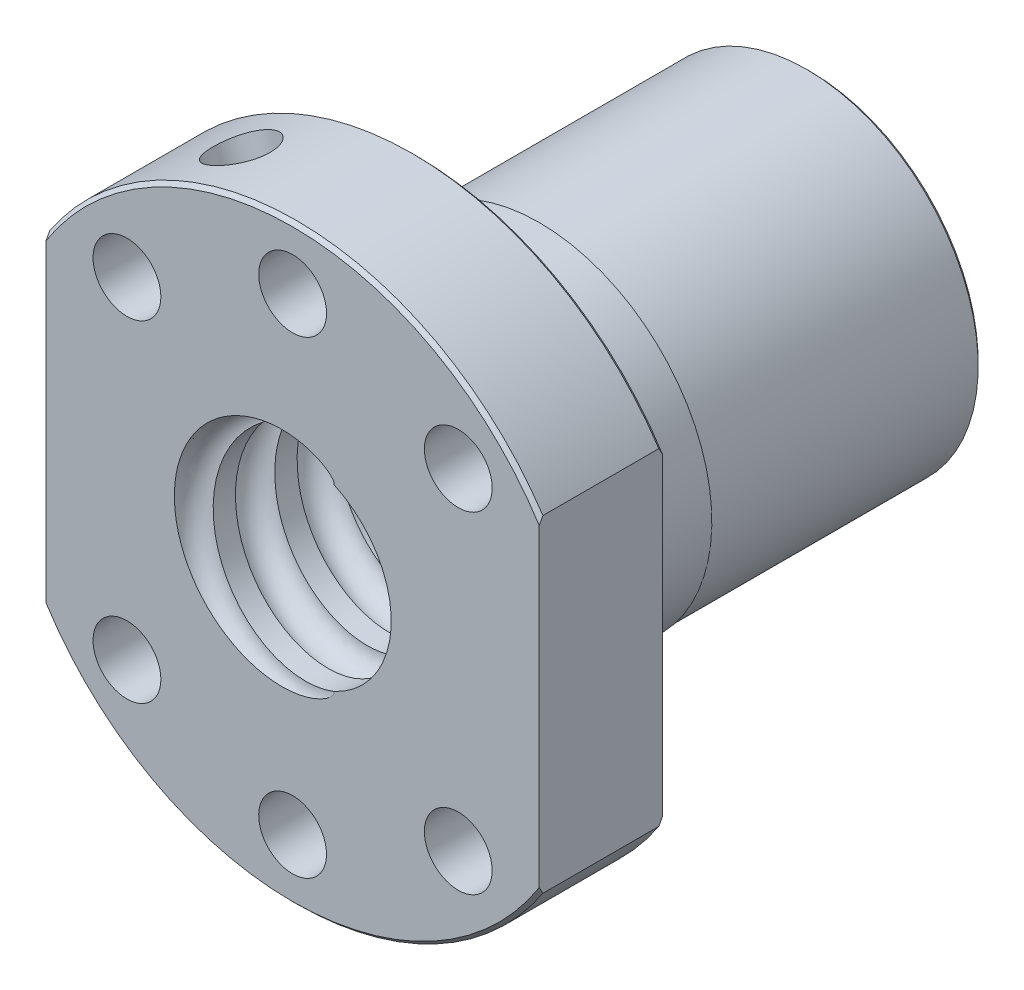
from build123d import *

# Parameters (mm, degrees)
SKETCH2_W                  = 14
SKETCH2_H                  = 26.532998322
CUT_EXTRUDE1_DEPTH         = 10
F_25_0_25_DIAMETER_HOLE1_D = 16
F_6_6_6_6_DIAMETER_HOLE1_D = 5.5
CIRPATTERN1_COUNT          = 8
SKETCH11_W                 = 2.5
SKETCH11_H                 = 29.826777428
CUT_SWEEP1_PITCH           = 5
CHAMFER1_SIZE              = 0.3


with BuildPart() as part:
    # Sketch1 → Revolve1 (revolve)
    with BuildSketch(Plane(origin=(0, 0, 0), x_dir=(0, 0, -1), z_dir=(1, 0, 0))):
        Polygon((0, 0), (0, 24), (10, 24), (10, 14), (20, 14), (20, 13.9), (42, 13.9), (42, 0), align=None)
    revolve(axis=Axis((0, 0, -42), (0, 0, 1)))

    # Sketch2 → Cut-Extrude1 (cut)
    with BuildSketch(Plane.XY):
        with Locations((-27, 0)):
            Rectangle(SKETCH2_W, SKETCH2_H)
        with Locations((27, 0)):
            Rectangle(SKETCH2_W, SKETCH2_H)
    extrude(amount=-CUT_EXTRUDE1_DEPTH, mode=Mode.SUBTRACT)

    # Ø25.0 (25) Diameter Hole1 (through all)
    with Locations(Plane(origin=(0, 0, -42), x_dir=(-1, 0, 0), z_dir=(0, 0, -1))):
        with Locations((0, 0)):
            Hole(F_25_0_25_DIAMETER_HOLE1_D / 2)

    # Ø6.6 (6.6) Diameter Hole1 (through all)
    with Locations(Plane.XY):
        with Locations((0, 19)):
            f_6_6_6_6_diameter_hole1 = Hole(F_6_6_6_6_DIAMETER_HOLE1_D / 2)

    # CirPattern1: Ø6.6 (6.6) Diameter Hole1 ×8 about axis, 2 skipped
    cirpattern1_axis = Axis((0, 0, 0), (0, 0, -1))
    add([f_6_6_6_6_diameter_hole1.rotate(cirpattern1_axis, i * 360 / CIRPATTERN1_COUNT) for i in range(1, CIRPATTERN1_COUNT) if i not in (2, 6)], mode=Mode.SUBTRACT)

    # Sketch11 → M6 Tapped Hole1 (revolve, cut)
    with BuildSketch(Plane(origin=(0, 0, -5), x_dir=(0.9238795325112864, 0.38268343236509056, 0), z_dir=(0, 0, 1))):
        with Locations((1.25, 14.913388714)):
            Rectangle(SKETCH11_W, SKETCH11_H)
    revolve(axis=Axis((2.430039796, -5.866635031, -5), (-0.38268343236509056, 0.9238795325112865, 0)), mode=Mode.SUBTRACT)

    # Cut-Sweep1: arcs per turn and ends read off the stored shape
    # Cut-Sweep1: the profile of Sketch13 screwed along a right-hand helix through 10.5 turns, 12 arcs to a turn; built about Z, then put on its axis
    cut_sweep1_z = Axis((0, 0, 0), (0, 0, 1))
    cut_sweep1_corners = [(9.5875, 0, 0), (8, 0.157136056, -1.579703931), (6.4125, 0, 0), (8, -0.157136056, 1.579703931)]
    with BuildLine(mode=Mode.PRIVATE) as cut_sweep1_profile:
        ThreePointArc((9.5875, 0, 0), (9.122532015, 0.111111971, -1.117019362), (8, 0.157136056, -1.579703931))
        ThreePointArc((8, 0.157136056, -1.579703931), (6.877467985, 0.111111971, -1.117019362), (6.4125, 0, 0))
        ThreePointArc((6.4125, 0, 0), (6.877467985, -0.111111971, 1.117019362), (8, -0.157136056, 1.579703931))
        ThreePointArc((8, -0.157136056, 1.579703931), (9.122532015, -0.111111971, 1.117019362), (9.5875, 0, 0))
    cut_sweep1_cap = Face(cut_sweep1_profile.wire())
    cut_sweep1_arcs = [((9.5875, 0, 0), (9.5875, 0.157136056, -1.579703931), (8, 0.157136056, -1.579703931), (1, 0.7071067811865476, 1)), ((8, 0.157136056, -1.579703931), (6.4125, 0.157136056, -1.579703931), (6.4125, 0, 0), (1, 0.7071067811865476, 1)), ((6.4125, 0, 0), (6.4125, -0.157136056, 1.579703931), (8, -0.157136056, 1.579703931), (1, 0.7071067811865476, 1)), ((8, -0.157136056, 1.579703931), (9.5875, -0.157136056, 1.579703931), (9.5875, 0, 0), (1, 0.7071067811865476, 1))]  # start, shoulder, end, weights
    cut_sweep1_turn_angles = [0, 15, 30, 45, 60, 75, 90, 105, 120, 135, 150, 165, 180, 195, 210, 225, 240, 255, 270, 285, 300, 315, 330, 345, 360]
    cut_sweep1_turn_weights = [1, 0.9659258262890683, 1, 0.9659258262890683, 1, 0.9659258262890683, 1, 0.9659258262890683, 1, 0.9659258262890683, 1, 0.9659258262890683, 1, 0.9659258262890683, 1, 0.9659258262890683, 1, 0.9659258262890683, 1, 0.9659258262890683, 1, 0.9659258262890683, 1, 0.9659258262890683, 1]
    cut_sweep1_turn_sides = [Face.make_bezier_surface([[Vector(p[j][0], p[j][1], 0).rotate(cut_sweep1_z, cut_sweep1_turn_angles[2 * i + k]) / cut_sweep1_turn_weights[2 * i + k] + Vector(0, 0, p[j][2] + CUT_SWEEP1_PITCH * cut_sweep1_turn_angles[2 * i + k] / 360) for k in range(3)] for j in range(3)], [[p[3][j] * cut_sweep1_turn_weights[2 * i + k] for k in range(3)] for j in range(3)]) for p in cut_sweep1_arcs for i in range(12)]
    cut_sweep1_last_angles = [3600, 3615, 3630, 3645, 3660, 3675, 3690, 3705, 3720, 3735, 3750, 3765, 3780]
    cut_sweep1_last_weights = [1, 0.9659258262890683, 1, 0.9659258262890683, 1, 0.9659258262890683, 1, 0.9659258262890683, 1, 0.9659258262890683, 1, 0.9659258262890785, 1]
    cut_sweep1_last_sides = [Face.make_bezier_surface([[Vector(p[j][0], p[j][1], 0).rotate(cut_sweep1_z, cut_sweep1_last_angles[2 * i + k]) / cut_sweep1_last_weights[2 * i + k] + Vector(0, 0, p[j][2] + CUT_SWEEP1_PITCH * cut_sweep1_last_angles[2 * i + k] / 360) for k in range(3)] for j in range(3)], [[p[3][j] * cut_sweep1_last_weights[2 * i + k] for k in range(3)] for j in range(3)]) for p in cut_sweep1_arcs for i in range(6)]
    cut_sweep1 = Plane(origin=(0, 0, 5), x_dir=(-1, 0, 0), z_dir=(0, 0, -1)) * Solid(Shell([*[p.moved(Location((0, 0, CUT_SWEEP1_PITCH * i))) for i in range(10) for p in cut_sweep1_turn_sides], *cut_sweep1_last_sides, cut_sweep1_cap, cut_sweep1_cap.rotate(cut_sweep1_z, 3780).moved(Location((0, 0, CUT_SWEEP1_PITCH * 3780 / 360)))]))
    add(cut_sweep1, mode=Mode.SUBTRACT)

    # Chamfer1
    chamfer1_edges = [part.edges().sort_by_distance(p)[0] for p in [
        (0, 24, -10),
        (0, 24, 0),
        (0, -24, -10),
        (0, -24, 0),
        (0, -13.9, -42),
    ]]
    chamfer(chamfer1_edges, length=CHAMFER1_SIZE)


solid = part.part
